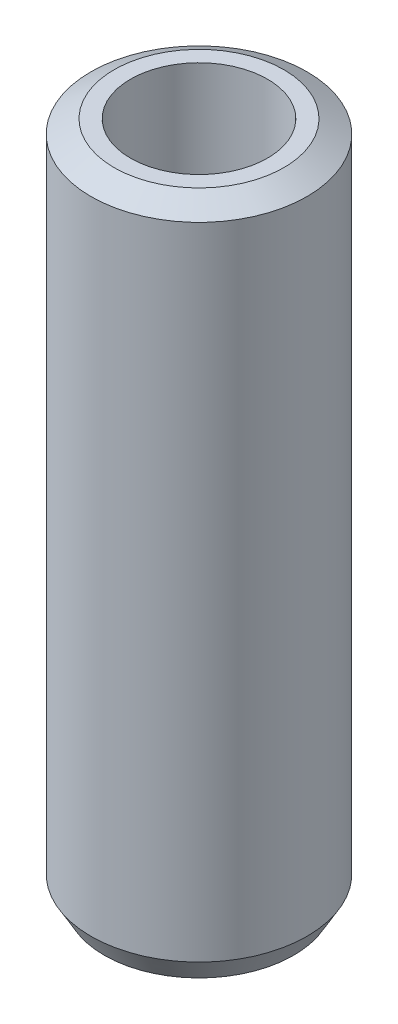
from build123d import *
from OCP.BRepFilletAPI import BRepFilletAPI_MakeChamfer

# Parameters (mm, degrees)
SKETCH1_R           = 22.5
BOSS_EXTRUDE1_DEPTH = 140.987925295
SKETCH2_R           = 14.260213031
CUT_EXTRUDE1_DEPTH  = 145.534062003
CHAMFER1_SIZE       = 2.788727604
CHAMFER1_SIZE2      = 4.830217898


with BuildPart() as part:
    # Sketch1 → Boss-Extrude1 (new body)
    with BuildSketch(Plane(origin=(0, 0, 0), x_dir=(1, 0, 0), z_dir=(0, 1, 0))):
        Circle(SKETCH1_R)
    extrude(amount=BOSS_EXTRUDE1_DEPTH)

    # Sketch2 → Cut-Extrude1 (cut, through all)
    with BuildSketch(Plane(origin=(0, 0, 0), x_dir=(1, 0, 0), z_dir=(0, 1, 0))):
        Circle(SKETCH2_R)
    extrude(amount=CUT_EXTRUDE1_DEPTH, mode=Mode.SUBTRACT)

    # Chamfer1: one chamfer whose edges measure the first distance from different faces: ONE call of the kernel's chamfer builder (chamfer() names one face for all edges)
    chamfer1_edges_1 = [part.edges().sort_by_distance(p)[0] for p in [
        (-22.5, 140.987925295, 0),
    ]]
    chamfer1_side_1 = [part.faces().sort_by_distance(p)[0] for p in [
        (-22.5, 70.493962648, 0),
    ]]
    chamfer1_edges_2 = [part.edges().sort_by_distance(p)[0] for p in [
        (-22.5, 0, 0),
    ]]
    chamfer1_side_2 = [part.faces().sort_by_distance(p)[0] for p in [
        (-21.863603897, 0, 0),
    ]]
    chamfer1 = BRepFilletAPI_MakeChamfer(part.part.solid().wrapped)
    for e in chamfer1_edges_1:
        chamfer1.Add(CHAMFER1_SIZE, CHAMFER1_SIZE2, e.wrapped, chamfer1_side_1[0].wrapped)  # the first distance lies on this face
    for e in chamfer1_edges_2:
        chamfer1.Add(CHAMFER1_SIZE, CHAMFER1_SIZE2, e.wrapped, chamfer1_side_2[0].wrapped)  # the first distance lies on this face
    add(Compound.cast(chamfer1.Shape()), mode=Mode.REPLACE)


solid = part.part
